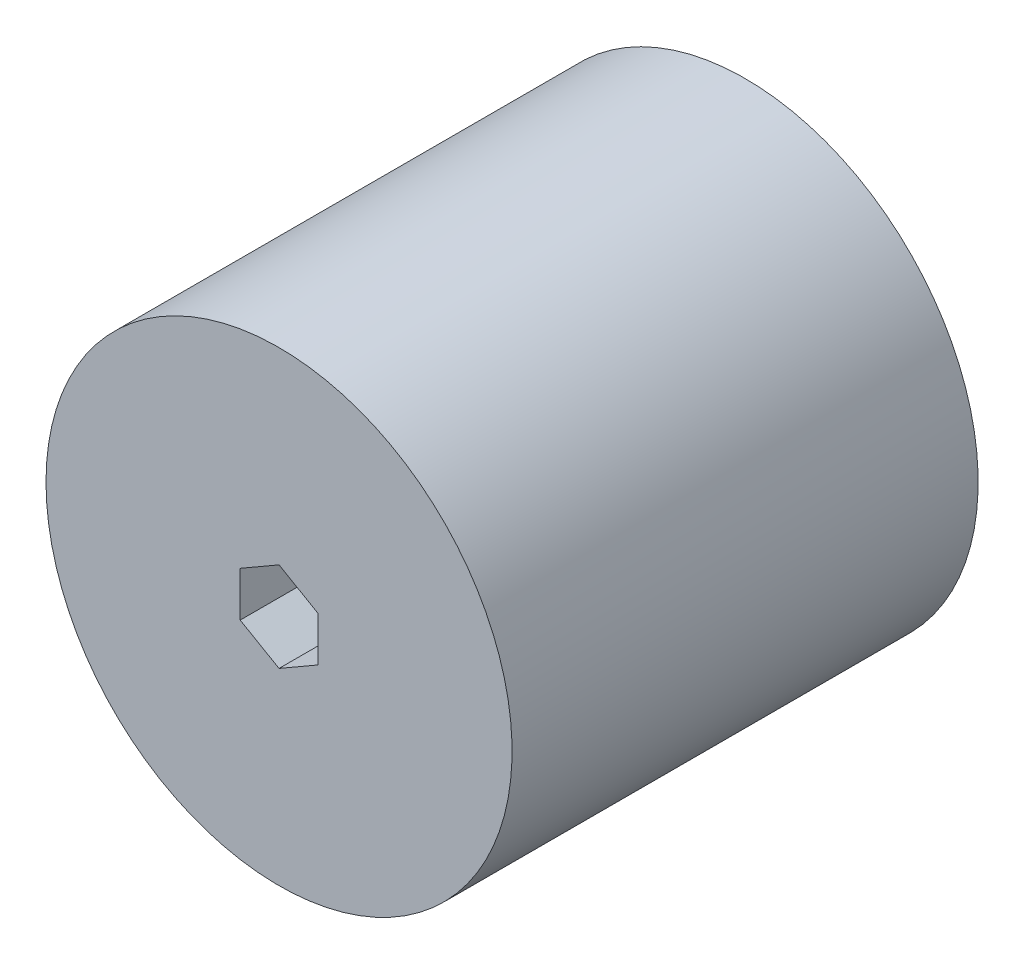
from build123d import *

# Parameters (mm, degrees)
SKETCH1_R           = 38.1
BOSS_EXTRUDE1_DEPTH = 76.2


with BuildPart() as part:
    # Sketch1 → Boss-Extrude1 (new body)
    with BuildSketch(Plane.XY):
        Circle(SKETCH1_R)
        Polygon((0, 7.332348419), (-6.35, 3.666174209), (-6.35, -3.666174209), (0, -7.332348419), (6.35, -3.666174209), (6.35, 3.666174209), align=None, mode=Mode.SUBTRACT)
    extrude(amount=BOSS_EXTRUDE1_DEPTH)


solid = part.part
